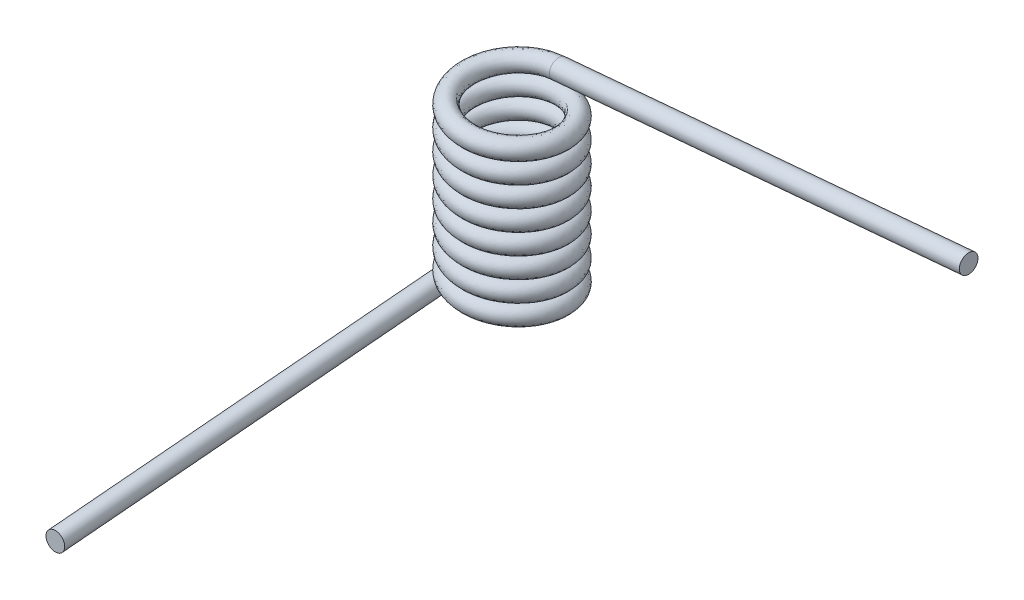
from build123d import *

# Parameters (mm, degrees)
SWEEP1_PITCH        = 2.1875
SWEEP1_HEIGHT       = 17.5
SWEEP1_RADIUS       = 5
SWEEP1_START_ANGLE  = -180
SKETCH2_R           = 1
SKETCH3_R           = 1
BOSS_EXTRUDE1_DEPTH = 44
SWEEP3_PITCH        = 2.1875
SWEEP3_HEIGHT       = 0.546875
SWEEP3_RADIUS       = 5
SKETCH5_R           = 1
SKETCH9_R           = 1
BOSS_EXTRUDE3_DEPTH = 44


with BuildPart() as part:
    # Sweep1: sweep along a helix
    with BuildLine() as sweep1_path:
        add(Helix(SWEEP1_PITCH, SWEEP1_HEIGHT, SWEEP1_RADIUS, center=(0, 0, 0), direction=(0, 1, 0), lefthand=True, mode=Mode.PRIVATE).rotate(Axis((0, 0, 0), (0, 1, 0)), SWEEP1_START_ANGLE))
    # Sketch2 → Sweep1 (sweep)
    with BuildSketch(Plane(origin=(0, 0, 0), x_dir=(0, 0, -1), z_dir=(1, 0, 0))):
        with Locations((5, 0)):
            Circle(SKETCH2_R)
    sweep(path=sweep1_path.line, is_frenet=True)

    # Sketch3 → Boss-Extrude1 (add, along a direction that is not the sketch's normal)
    with BuildSketch(Plane(origin=(0, 0, 0), x_dir=(0, 0, -1), z_dir=(1, 0, 0))):
        with Locations((5, 17.5)):
            Circle(SKETCH3_R)
    extrude(amount=BOSS_EXTRUDE1_DEPTH, dir=(0.9961946980917459, 0.08715574274765461, 0))

    # Sweep3: sweep along a helix
    with BuildLine() as sweep3_path:
        Helix(SWEEP3_PITCH, SWEEP3_HEIGHT, SWEEP3_RADIUS, center=(0, 0, 0), direction=(0, -1, 0), lefthand=True)
    # Sketch5 → Sweep3 (sweep)
    with BuildSketch(Plane.ZY):
        with Locations((-5, 0)):
            Circle(SKETCH5_R)
    sweep(path=sweep3_path.line, is_frenet=True)

    # Sketch9 → Boss-Extrude3 (add, along a direction that is not the sketch's normal)
    with BuildSketch(Plane.XY):
        with Locations((-5, -0.546875)):
            Circle(SKETCH9_R)
    extrude(amount=BOSS_EXTRUDE3_DEPTH, dir=(0, -0.08715574274765554, 0.9961946980917458))


solid = part.part
